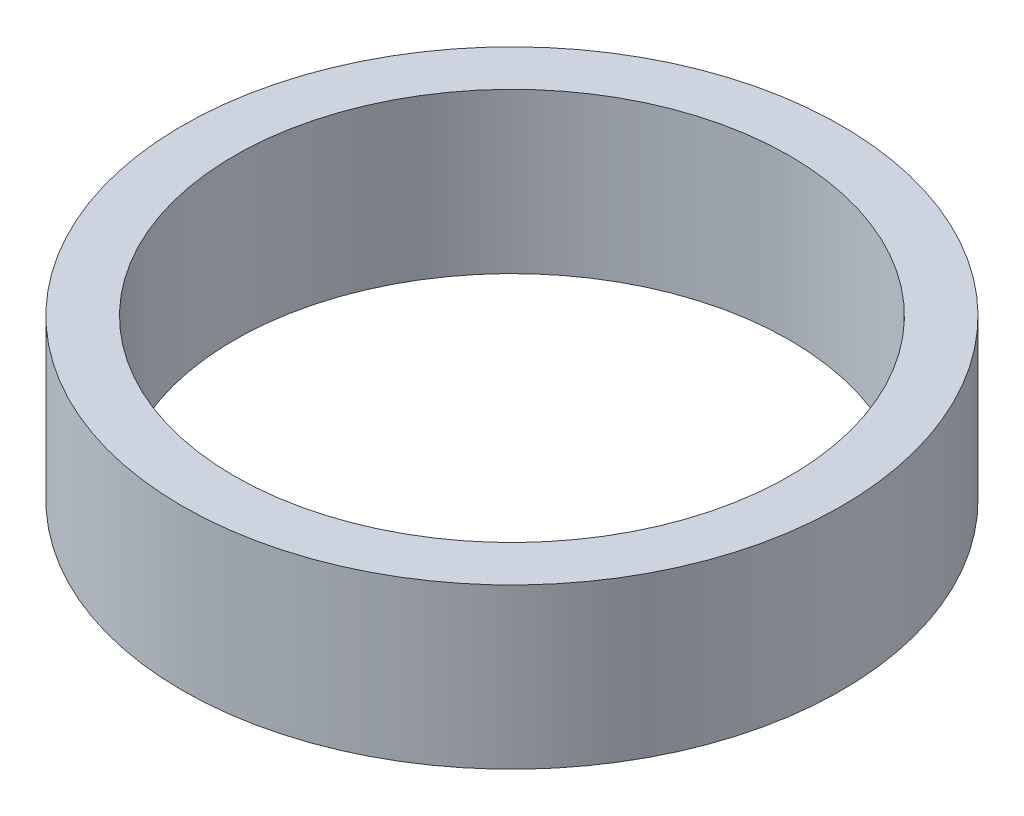
from build123d import *

# Parameters (mm, degrees)
SKETCH1_R           = 47.5
BOSS_EXTRUDE1_DEPTH = 23
SKETCH2_R           = 40
CUT_EXTRUDE1_DEPTH  = 72.003521039


with BuildPart() as part:
    # Sketch1 → Boss-Extrude1 (new body)
    with BuildSketch(Plane(origin=(0, 0, 0), x_dir=(1, 0, 0), z_dir=(0, 1, 0))):
        Circle(SKETCH1_R)
    extrude(amount=BOSS_EXTRUDE1_DEPTH)

    # Sketch2 → Cut-Extrude1 (cut, through all)
    with BuildSketch(Plane(origin=(0, 0, 0), x_dir=(1, 0, 0), z_dir=(0, 1, 0))):
        Circle(SKETCH2_R)
    extrude(amount=CUT_EXTRUDE1_DEPTH, mode=Mode.SUBTRACT)


solid = part.part
